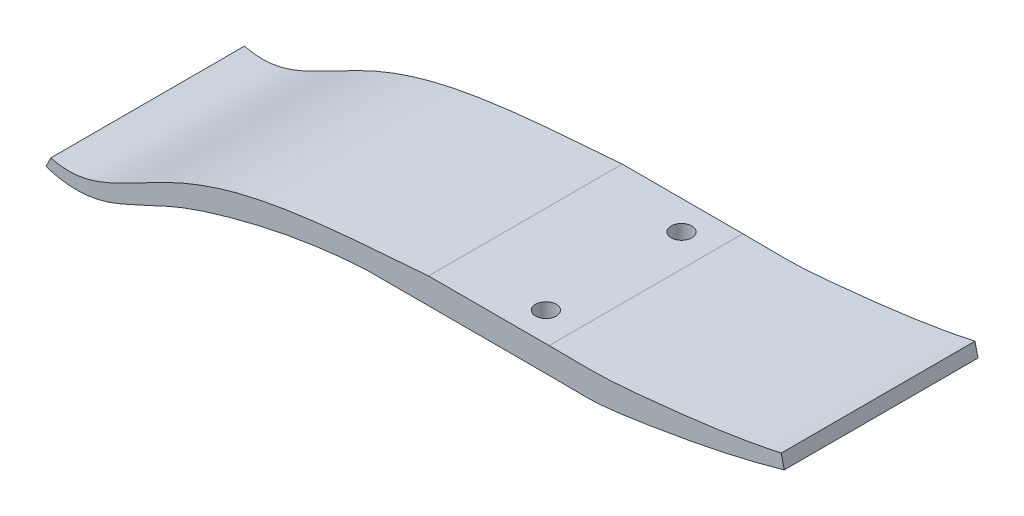
from build123d import *

# Parameters (mm, degrees)
ESTRUSIONE_ESTRUSIONE1_DEPTH = 60
SCHIZZO2_R                   = 3.2
TAGLIO_ESTRUSIONE1_DEPTH     = 233.889820397


with BuildPart() as part:
    # Schizzo1 → Estrusione-Estrusione1 (new body)
    with BuildSketch(Plane.XY):
        with BuildLine():
            Line((150, 0), (112.652759777, 0))
            add(Edge.make_bspline(
                [(112.652759777, 0), (98.237662575, -1.178240864), (76.325416845, -2.367087178), (50.386085211, -7.715299834), (33.034853179, -14.26020997), (17.005808568, -23.385929695), (4.046336606, -28.877814003), (-3.966333357, -26.937004661)],
                knots=[0, 0, 0, 0, 0.357718306, 0.541412235, 0.651991695, 0.814467727, 0.997098774, 0.997098774, 0.997098774, 0.997098774], degree=3))
            add(Edge.make_bspline(
                [(-3.966333357, -26.937004661), (-4.093620386, -26.906173508), (-4.221198761, -26.874119155), (-4.34907219, -26.840823763)],
                knots=[0.997098774, 0.997098774, 0.997098774, 0.997098774, 1, 1, 1, 1], degree=3))
            Line((-4.34907219, -26.840823763), (-5.819646619, -29.843392582))
            add(Edge.make_bspline(
                [(93.176931163, -8), (78.095796931, -8.806994611), (58.515182539, -12.465092597), (33.425903267, -20.492787938), (21.868566108, -26.59175254), (8.46872535, -31.84989808), (-0.020847935, -31.917998972), (-5.819646619, -29.843392582)],
                knots=[0, 0, 0, 0, 0.439768474, 0.579665595, 0.767580002, 0.820026739, 1, 1, 1, 1], degree=3))
            Line((93.176931163, -8), (150, -8))
            add(Edge.make_bspline(
                [(150, -8), (160.934675431, -8.178500572), (167.732636416, -7.981403235), (191.218183044, -4.400657167), (208.863871924, -0.957960193), (222.824656402, 3.062271003)],
                knots=[0, 0, 0, 0, 0.132806244, 0.367168858, 1, 1, 1, 1], degree=3))
            Line((222.824656402, 3.062271003), (221.895107654, 7.130147587))
            add(Edge.make_bspline(
                [(150, 0), (155.186432149, -0.071874262), (162.776030143, -0.192676418), (171.94252973, 0.198053168), (191.054206551, 2.042329396), (208.370998681, 4.160926661), (221.895107654, 7.130147587)],
                knots=[0, 0, 0, 0, 0.180513483, 0.221559148, 0.410456652, 1, 1, 1, 1], degree=3))
        make_face()
    extrude(amount=-ESTRUSIONE_ESTRUSIONE1_DEPTH)

    # Schizzo2 → Taglio-Estrusione1 (cut, through all)
    with BuildSketch(Plane(origin=(0, 0, 0), x_dir=(1, 0, 0), z_dir=(0, 1, 0))):
        with Locations((140, 51)):
            Circle(SCHIZZO2_R)
        with Locations((140, 9)):
            Circle(SCHIZZO2_R)
    extrude(amount=-TAGLIO_ESTRUSIONE1_DEPTH, mode=Mode.SUBTRACT)


solid = part.part
